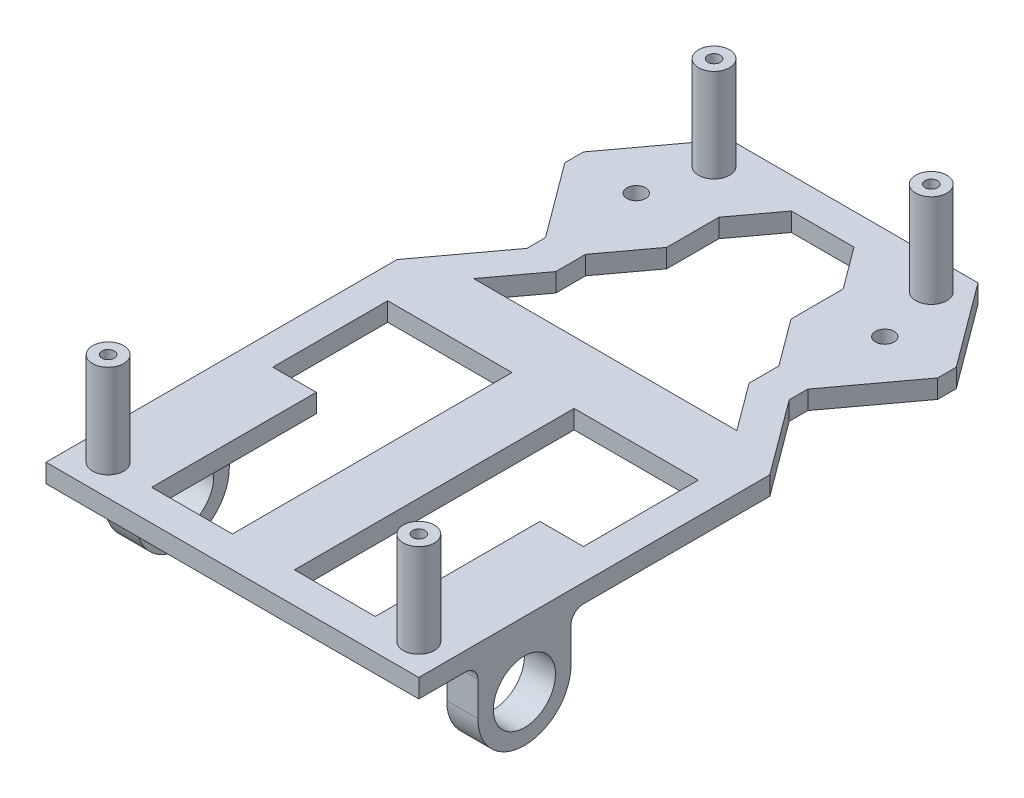
from build123d import *

# Parameters (mm, degrees)
SKETCH2_R               = 1.5
BOSS_EXTRUDE1_DEPTH     = 3
SKETCH5_W               = 5
SKETCH5_H               = 15
BOSS_EXTRUDE3_DEPTH     = 15
CUT_EXTRUDE1_DEPTH      = 118.579760163
CUT_EXTRUDE1_DEPTH_BACK = 118.579760163
SKETCH6_R               = 5
FILLET1_R               = 7.5
FILLET2_R               = 2
SKETCH7_R               = 2.5
SKETCH7_R_2             = 1
BOSS_EXTRUDE4_DEPTH     = 15
CUT_EXTRUDE2_DEPTH      = 106.943381105
CUT_EXTRUDE2_DEPTH_BACK = 106.943381105
BOSS_EXTRUDE5_DEPTH     = 3


with BuildPart() as part:
    # Sketch2 → Boss-Extrude1 (new body)
    with BuildSketch(Plane(origin=(0, 0, 0), x_dir=(1, 0, 0), z_dir=(0, 1, 0))):
        Polygon((30, 0), (-30, 0), (-30, 56.5), (-21.111111111, 68.5), (-21.111111111, 71.5), (-30, 83.5), (-30, 86.5), (-20, 100), (20, 100), (30, 86.5), (30, 83.5), (21.111111111, 71.5), (21.111111111, 68.5), (30, 56.5), align=None)
        with Locations(Location((-20, 85, 0), (0, 0, 270))):
            Circle(SKETCH2_R, mode=Mode.SUBTRACT)
        with Locations(Location((20, 85, 0), (0, 0, 90))):
            Circle(SKETCH2_R, mode=Mode.SUBTRACT)
    extrude(amount=BOSS_EXTRUDE1_DEPTH)

    # Sketch5 → Boss-Extrude3 (add)
    with BuildSketch(Plane.XZ):
        with Locations((-27.5, -17)):
            Rectangle(SKETCH5_W, SKETCH5_H)
        with Locations((27.5, -17)):
            Rectangle(SKETCH5_W, SKETCH5_H)
    extrude(amount=BOSS_EXTRUDE3_DEPTH)

    # Sketch6 → Cut-Extrude1 (cut, two sides: drawn at the far end of the back side and taken through both)
    with BuildSketch(Plane.ZY.offset(30).offset(-CUT_EXTRUDE1_DEPTH_BACK)):
        with Locations((-17, -7.5)):
            Circle(SKETCH6_R)
    extrude(amount=CUT_EXTRUDE1_DEPTH + CUT_EXTRUDE1_DEPTH_BACK, mode=Mode.SUBTRACT)

    # Fillet1
    fillet1_edges = [part.edges().sort_by_distance(p)[0] for p in [
        (27.5, -15, -9.5),
        (27.5, -15, -24.5),
        (-27.5, -15, -24.5),
        (-27.5, -15, -9.5),
    ]]
    fillet(fillet1_edges, radius=FILLET1_R - 0.0001)  # a hair under: the kernel refuses the full size

    # Fillet2
    fillet2_edges = [part.edges().sort_by_distance(p)[0] for p in [
        (-27.5, 0, -24.5),
        (-25, 0, -17),
        (-27.5, 0, -9.5),
        (25, 0, -17),
        (27.5, 0, -24.5),
        (27.5, 0, -9.5),
    ]]
    fillet(fillet2_edges, radius=FILLET2_R)

    # Sketch7 → Boss-Extrude4 (add)
    # profile 1 of 4: a face of its own
    with BuildSketch(Plane(origin=(0, 3, 0), x_dir=(1, 0, 0), z_dir=(0, 1, 0))):
        with Locations(Location((25, 5, 0), (0, 0, 270))):
            Circle(SKETCH7_R)
        with Locations(Location((25, 5, 0), (0, 0, 270))):
            Circle(SKETCH7_R_2, mode=Mode.SUBTRACT)
    # profile 2 of 4: a face of its own
    with BuildSketch(Plane(origin=(0, 3, 0), x_dir=(1, 0, 0), z_dir=(0, 1, 0))):
        with Locations(Location((-25, 5, 0), (0, 0, 90))):
            Circle(SKETCH7_R)
        with Locations(Location((-25, 5, 0), (0, 0, 90))):
            Circle(SKETCH7_R_2, mode=Mode.SUBTRACT)
    # profile 3 of 4: a face of its own
    with BuildSketch(Plane(origin=(0, 3, 0), x_dir=(1, 0, 0), z_dir=(0, 1, 0))):
        with Locations(Location((17.481371253, 95, 0), (0, 0, 270))):
            Circle(SKETCH7_R)
        with Locations(Location((17.481371253, 95, 0), (0, 0, 270))):
            Circle(SKETCH7_R_2, mode=Mode.SUBTRACT)
    # profile 4 of 4: a face of its own
    with BuildSketch(Plane(origin=(0, 3, 0), x_dir=(1, 0, 0), z_dir=(0, 1, 0))):
        with Locations(Location((-17.481371253, 95, 0), (0, 0, 90))):
            Circle(SKETCH7_R)
        with Locations(Location((-17.481371253, 95, 0), (0, 0, 90))):
            Circle(SKETCH7_R_2, mode=Mode.SUBTRACT)
    extrude(amount=BOSS_EXTRUDE4_DEPTH)

    # Sketch8 → Cut-Extrude2 (cut, two sides: drawn at the far end of the back side and taken through both)
    with BuildSketch(Plane.XZ.offset(-CUT_EXTRUDE2_DEPTH_BACK)):
        Polygon((-18, -5), (-18, -31.5), (-25, -31.5), (-25, -54.849851192), (-15.555279985, -67.600223212), (-15.555279985, -72.399776788), (-10, -79.899404767), (-10, -88.299553575), (-5.036706352, -95), (5.036706352, -95), (10, -88.299553575), (10, -79.899404767), (15.555279985, -72.399776788), (15.555279985, -67.600223212), (25, -54.849851192), (25, -31.5), (18, -31.5), (18, -5), align=None)
    extrude(amount=CUT_EXTRUDE2_DEPTH + CUT_EXTRUDE2_DEPTH_BACK, mode=Mode.SUBTRACT)

    # Sketch9 → Boss-Extrude5 (add)
    with BuildSketch(Plane(origin=(0, 0, 0), x_dir=(1, 0, 0), z_dir=(0, 1, 0))):
        Polygon((-25, 50), (-5, 50), (-5, 0), (5, 0), (5, 50), (25, 50), (25, 54.849851192), (21.185074957, 60), (-21.185074957, 60), (-25, 54.849851192), align=None)
    extrude(amount=BOSS_EXTRUDE5_DEPTH)


solid = part.part
